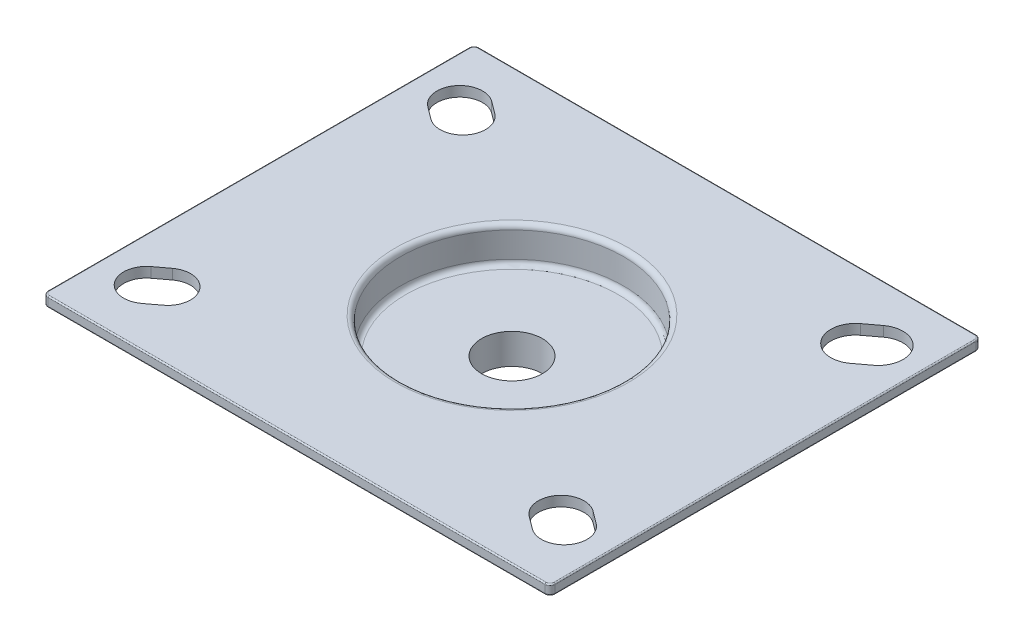
from build123d import *

# Parameters (mm, degrees)
SKETCH_2_W          = 100
SKETCH_2_H          = 85
SKETCH_2_R          = 6
EXTRUDE_1_DEPTH     = 2
SKETCH_3_R          = 25
EXTRUDE_2_DEPTH     = 10
SHELL_1_T           = 3
FILLET_1_R          = 1
SKETCH_5_R          = 13.33227761
EXTRUDE_3_DEPTH     = 6
SKETCH_4_R          = 6
CUT_EXTRUDE_2_DEPTH = 19.9
FILLET_3_R          = 1
FILLET_4_R          = 0.25


with BuildPart() as part:
    # Эскиз2 → Бобышка-Вытянуть1 (new body)
    with BuildSketch(Plane(origin=(0, 0, 0), x_dir=(1, 0, 0), z_dir=(0, 1, 0))):
        Rectangle(SKETCH_2_W, SKETCH_2_H)
        with Locations(Location((0, 0, 0), (0, 0, 270))):
            Circle(SKETCH_2_R, mode=Mode.SUBTRACT)
        with BuildLine():
            Line((35.797740165, 32.912374401), (38.380753328, 34.849634274))
            ThreePointArc((38.380753328, 34.849634274), (45.172510919, 33.879383189), (44.202259835, 27.087625599))
            Line((44.202259835, 27.087625599), (41.619246672, 25.150365726))
            ThreePointArc((41.619246672, 25.150365726), (34.827489081, 26.120616811), (35.797740165, 32.912374401))
        make_face(mode=Mode.SUBTRACT)
        with BuildLine():
            Line((-38.5, 34.5), (-36.1, 32.7))
            ThreePointArc((-36.1, 32.7), (-35.2, 26.4), (-41.5, 25.5))
            Line((-41.5, 25.5), (-43.9, 27.3))
            ThreePointArc((-43.9, 27.3), (-44.8, 33.6), (-38.5, 34.5))
        make_face(mode=Mode.SUBTRACT)
        with BuildLine():
            Line((38.5, -34.5), (36.1, -32.7))
            ThreePointArc((36.1, -32.7), (35.2, -26.4), (41.5, -25.5))
            Line((41.5, -25.5), (43.9, -27.3))
            ThreePointArc((43.9, -27.3), (44.8, -33.6), (38.5, -34.5))
        make_face(mode=Mode.SUBTRACT)
        with BuildLine():
            Line((-43.9, -27.3), (-41.5, -25.5))
            ThreePointArc((-41.5, -25.5), (-35.2, -26.4), (-36.1, -32.7))
            Line((-36.1, -32.7), (-38.5, -34.5))
            ThreePointArc((-38.5, -34.5), (-44.8, -33.6), (-43.9, -27.3))
        make_face(mode=Mode.SUBTRACT)
    extrude(amount=EXTRUDE_1_DEPTH)

    # Эскиз3 → Бобышка-Вытянуть2 (add)
    with BuildSketch(Plane(origin=(0, 2, 0), x_dir=(1, 0, 0), z_dir=(0, 1, 0))):
        with Locations(Location((0, 0, 0), (0, 0, 270))):
            Circle(SKETCH_3_R)
    extrude(amount=-EXTRUDE_2_DEPTH)

    # Оболочка1
    # the kernel refuses this shell: the inside is offset whole and opened at the faces by hand
    shell_1_offset = offset(amount=-SHELL_1_T, mode=Mode.PRIVATE)
    shell_1_offset = shell_1_offset + extrude(shell_1_offset.faces().sort_by_distance((0, -1, 0))[0], amount=SHELL_1_T, mode=Mode.PRIVATE)
    add(shell_1_offset, mode=Mode.SUBTRACT)

    # Скругление1
    fillet_1_edges = [part.edges().sort_by_distance(p)[0] for p in [
        (0, 0, -25),
        (0, -8, -25),
        (0, -5, -22),
        (0, 2, -22),
    ]]
    fillet(fillet_1_edges, radius=FILLET_1_R)

    # Эскиз5 → Бобышка-Вытянуть3 (add)
    with BuildSketch(Plane(origin=(0, -5, 0), x_dir=(1, 0, 0), z_dir=(0, 1, 0))):
        with Locations(Location((0, 0, 0), (0, 0, 270))):
            Circle(SKETCH_5_R)
    extrude(amount=-EXTRUDE_3_DEPTH)

    # Эскиз4 → Вырез-Вытянуть2 (cut, symmetric)
    with BuildSketch(Plane(origin=(0, -5, 0), x_dir=(1, 0, 0), z_dir=(0, 1, 0))):
        with Locations(Location((0, 0, 0), (0, 0, 270))):
            Circle(SKETCH_4_R)
    extrude(amount=CUT_EXTRUDE_2_DEPTH, both=True, mode=Mode.SUBTRACT)

    # Скругление3
    fillet_3_edges = [part.edges().sort_by_distance(p)[0] for p in [
        (50, 1, 42.5),
        (-50, 1, 42.5),
        (-50, 1, -42.5),
        (50, 1, -42.5),
    ]]
    fillet(fillet_3_edges, radius=FILLET_3_R)

    # Скругление4
    fillet_4_edges = [part.edges().sort_by_distance(p)[0] for p in [
        (50, 0, 0),
        (50, 2, 0),
        (0, 0, 42.5),
        (-50, 0, 0),
        (0, 0, -42.5),
        (-49.707106781, 0, 42.207106781),
        (-49.707106781, 0, -42.207106781),
        (49.707106781, 0, -42.207106781),
        (49.707106781, 0, 42.207106781),
        (0, 2, 42.5),
        (0, 2, -42.5),
        (-50, 2, 0),
        (-49.707106781, 2, 42.207106781),
        (-49.707106781, 2, -42.207106781),
        (49.707106781, 2, -42.207106781),
        (49.707106781, 2, 42.207106781),
    ]]
    fillet(fillet_4_edges, radius=FILLET_4_R)


solid = part.part
